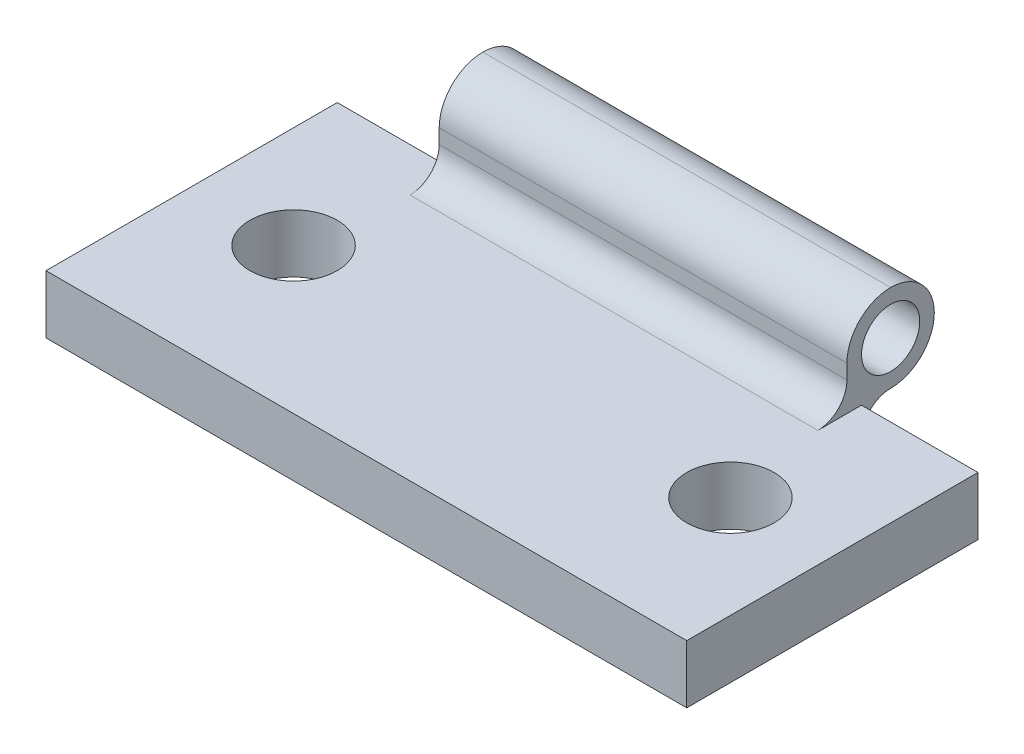
from build123d import *

# Parameters (mm, degrees)
SKETCH2_W           = 22
SKETCH2_H           = 10
SKETCH2_R           = 1.5
BOSS_EXTRUDE1_DEPTH = 2
SKETCH3_W           = 3
SKETCH3_H           = 3
SKETCH3_R           = 1
BOSS_EXTRUDE2_DEPTH = 7
FILLET1_R           = 1.5
FILLET2_R           = 1
FILLET3_R           = 1.5


with BuildPart() as part:
    # Sketch2 → Boss-Extrude1 (new body)
    with BuildSketch(Plane(origin=(0, 0, 0), x_dir=(1, 0, 0), z_dir=(0, 1, 0))):
        Rectangle(SKETCH2_W, SKETCH2_H)
        with Locations(Location((-7.5, 0, 0), (0, 0, 270))):
            Circle(SKETCH2_R, mode=Mode.SUBTRACT)
        with Locations(Location((7.5, 0, 0), (0, 0, 270))):
            Circle(SKETCH2_R, mode=Mode.SUBTRACT)
    extrude(amount=BOSS_EXTRUDE1_DEPTH)

    # Sketch3 → Boss-Extrude2 (add, symmetric)
    with BuildSketch(Plane(origin=(0, 0, 0), x_dir=(0, 0, -1), z_dir=(1, 0, 0))):
        with Locations((6, 3.5)):
            Rectangle(SKETCH3_W, SKETCH3_H)
        with Locations((6, 3.5)):
            Circle(SKETCH3_R, mode=Mode.SUBTRACT)
    extrude(amount=BOSS_EXTRUDE2_DEPTH, both=True)

    # Fillet1
    fillet1_edges = [part.edges().sort_by_distance(p)[0] for p in [
        (0, 5, -4.5),
        (0, 5, -7.5),
    ]]
    fillet(fillet1_edges, radius=FILLET1_R - 0.0001)  # a hair under: the kernel refuses the full size

    # Fillet2
    fillet2_edges = [part.edges().sort_by_distance(p)[0] for p in [
        (0, 2, -5),
        (0, 2, -4.5),
    ]]
    fillet(fillet2_edges, radius=FILLET2_R)

    # Fillet3
    fillet3_edges = [part.edges().sort_by_distance(p)[0] for p in [
        (0, 2, -7.5),
    ]]
    fillet(fillet3_edges, radius=FILLET3_R - 0.0001)  # a hair under: the kernel refuses the full size


solid = part.part
